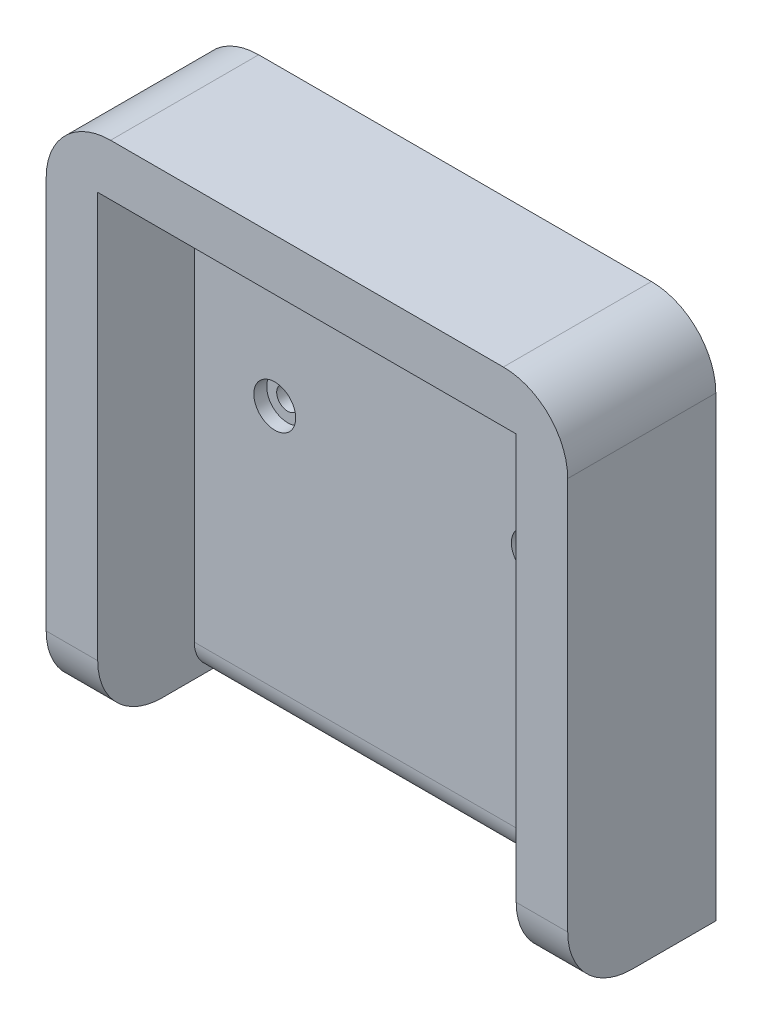
from build123d import *

# Parameters (mm, degrees)
ESQUISSE1_W                                          = 81
ESQUISSE1_H                                          = 81
BOSS_EXTRU_1_DEPTH                                   = 8
BOSS_EXTRU_2_DEPTH                                   = 15
CONG_1_R                                             = 10
CONG_2_R                                             = 5
CHAMBRAGE_POUR_T_TE_CYLINDRIQUE_FENDUE_M_D           = 3.4
CHAMBRAGE_POUR_T_TE_CYLINDRIQUE_FENDUE_M_CBORE_D     = 6.5
CHAMBRAGE_POUR_T_TE_CYLINDRIQUE_FENDUE_M_CBORE_DEPTH = 2


with BuildPart() as part:
    # Esquisse1 → Boss.-Extru.1 (new body)
    with BuildSketch(Plane.XY):
        with Locations((40.5, 40.5)):
            Rectangle(ESQUISSE1_W, ESQUISSE1_H)
    extrude(amount=BOSS_EXTRU_1_DEPTH)

    # Esquisse2 → Boss.-Extru.2 (add)
    with BuildSketch(Plane.XY.offset(8)):
        Polygon((0, 81), (81, 81), (81, 0), (73, 0), (73, 73), (8, 73), (8, 0), (0, 0), align=None)
    extrude(amount=BOSS_EXTRU_2_DEPTH)

    # Congé1
    cong_1_edges = [part.edges().sort_by_distance(p)[0] for p in [
        (0, 81, 11.5),
        (81, 81, 11.5),
        (77, 0, 23),
        (4, 0, 23),
    ]]
    fillet(cong_1_edges, radius=CONG_1_R)

    # Congé2
    cong_2_edges = [part.edges().sort_by_distance(p)[0] for p in [
        (40.5, 0, 8),
    ]]
    fillet(cong_2_edges, radius=CONG_2_R)

    # Chambrage pour tête cylindrique fendue M31 (through all)
    with Locations(Plane.XY.offset(8)):
        with Locations((20.5, 43), (60.5, 43)):
            CounterBoreHole(CHAMBRAGE_POUR_T_TE_CYLINDRIQUE_FENDUE_M_D / 2, CHAMBRAGE_POUR_T_TE_CYLINDRIQUE_FENDUE_M_CBORE_D / 2, CHAMBRAGE_POUR_T_TE_CYLINDRIQUE_FENDUE_M_CBORE_DEPTH)


solid = part.part
